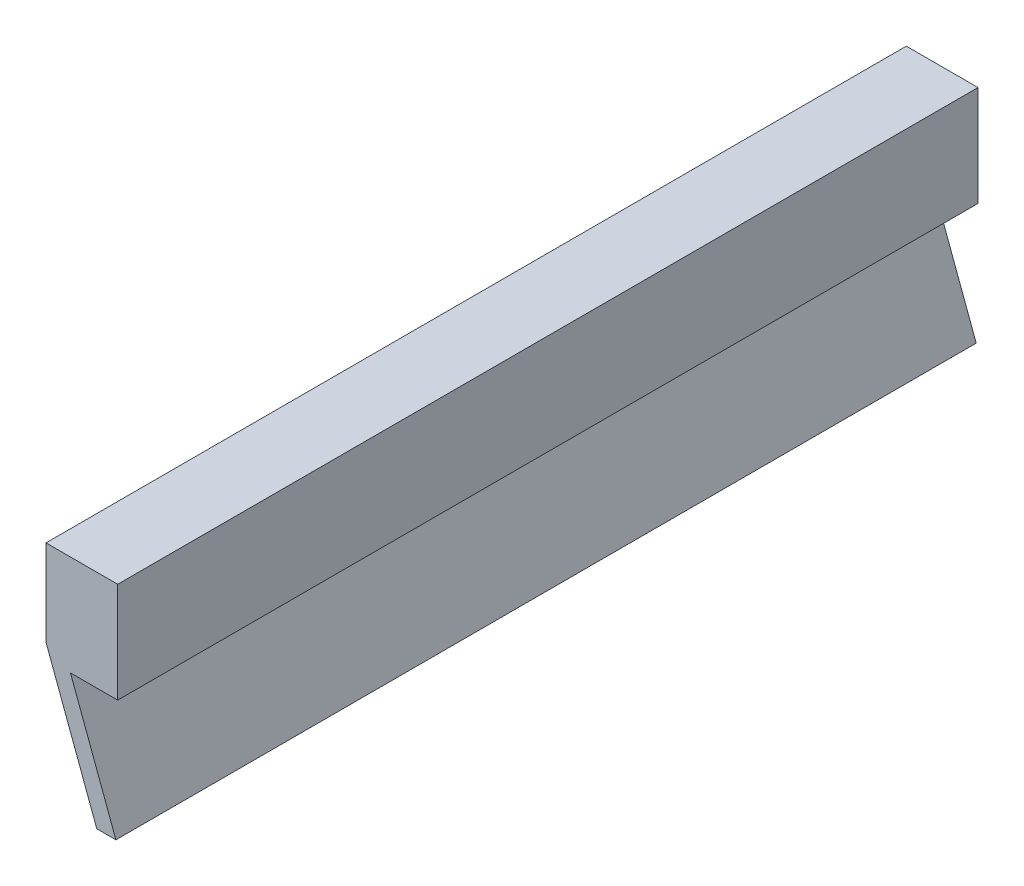
from build123d import *

# Parameters (mm, degrees)
SALIENTE_EXTRUIR1_DEPTH = 60


with BuildPart() as part:
    # Croquis1 → Saliente-Extruir1 (new, symmetric)
    with BuildSketch(Plane.XY):
        Polygon((-6.586509369, 0), (0, 0), (0, 14), (-10, 14), (-10, 2), (-2.91801894, -17), (-0.25, -17), align=None)
    extrude(amount=SALIENTE_EXTRUIR1_DEPTH, both=True)


solid = part.part
